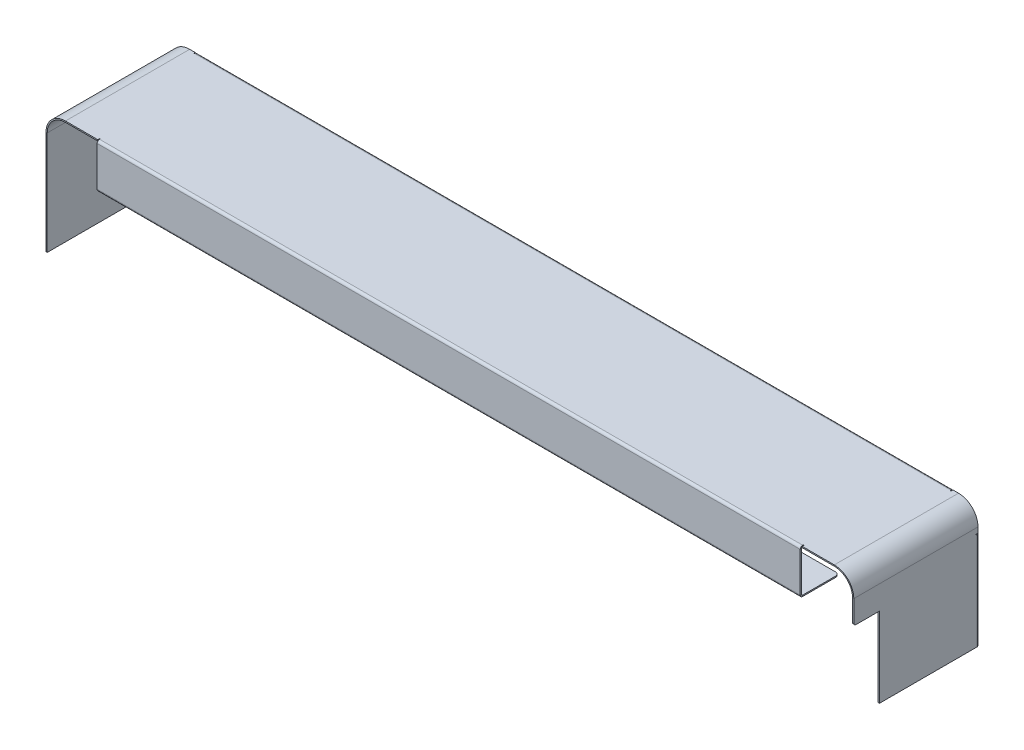
from build123d import *

# Parameters (mm, degrees)
BASE_FLANGE1_DEPTH             = 102
EDGE_FLANGE1_STRIP_W           = 6
EDGE_FLANGE1_STRIP_H           = 1
EDGE_FLANGE1_STRIP_CUT_DEPTH   = 621.4
EDGE_FLANGE1_RELIEF_W          = 6.5
EDGE_FLANGE1_RELIEF_H          = 0.5
EDGE_FLANGE1_RELIEF_CUT_DEPTH  = 1
EDGE_FLANGE1_DEPTH             = 621.4
EDGE_FLANGE2_STRIP_W           = 6
EDGE_FLANGE2_STRIP_H           = 1
EDGE_FLANGE2_STRIP_CUT_DEPTH   = 621.4
EDGE_FLANGE2_DEPTH             = 621.4
EDGE_FLANGE3_STRIP_W           = 6
EDGE_FLANGE3_STRIP_H           = 1
EDGE_FLANGE3_STRIP_CUT_DEPTH   = 80
EDGE_FLANGE3_RELIEF_W          = 6.5
EDGE_FLANGE3_RELIEF_H          = 0.5
EDGE_FLANGE3_RELIEF_CUT_DEPTH  = 1
EDGE_FLANGE3_DEPTH             = 80
EDGE_FLANGE4_STRIP_W           = 6
EDGE_FLANGE4_STRIP_H           = 1
EDGE_FLANGE4_STRIP_CUT_DEPTH   = 80
EDGE_FLANGE4_DEPTH             = 80
EDGE_FLANGE5_STRIP_W           = 6
EDGE_FLANGE5_STRIP_H           = 1
EDGE_FLANGE5_STRIP_CUT_DEPTH   = 577.4
EDGE_FLANGE5_RELIEF_W          = 6.5
EDGE_FLANGE5_RELIEF_H          = 0.5
EDGE_FLANGE5_RELIEF_CUT_DEPTH  = 1
EDGE_FLANGE5_DEPTH             = 577.4
SKETCH25_R                     = 2.5
CUT_EXTRUDE1_DEPTH             = 3
SKETCH26_R                     = 2.5
CUT_EXTRUDE2_DEPTH             = 3
CUT_EXTRUDE2_DIRECTION_2_REACH = 661.221
EDGE_FLANGE7_STRIP_W           = 6
EDGE_FLANGE7_STRIP_H           = 1
EDGE_FLANGE7_STRIP_CUT_DEPTH   = 577.4
EDGE_FLANGE7_DEPTH             = 577.4
EDGE_FLANGE7_FLAT_DEPTH        = 1
SKETCH30_W                     = 21
SKETCH30_H                     = 65.6
CUT_EXTRUDE3_DEPTH             = 10
FILLET1_R                      = 2


# Sheet-metal steps are written as plain solids
with BuildPart() as part:
    # Sketch1 → Base-Flange1 (new body)
    with BuildSketch(Plane.XY):
        with BuildLine():
            Line((-330.7, -100), (-330.7, -15))
            ThreePointArc((-330.7, -15), (-326.306601718, -4.393398282), (-315.7, 0))
            Line((-315.7, 0), (315.7, 0))
            ThreePointArc((315.7, 0), (326.306601718, -4.393398282), (330.7, -15))
            Line((330.7, -15), (330.7, -100))
            Line((330.7, -100), (331.7, -100))
            Line((331.7, -100), (331.7, -15))
            ThreePointArc((331.7, -15), (327.013708499, -3.686291501), (315.7, 1))
            Line((315.7, 1), (-315.7, 1))
            ThreePointArc((-315.7, 1), (-327.013708499, -3.686291501), (-331.7, -15))
            Line((-331.7, -15), (-331.7, -100))
            Line((-331.7, -100), (-330.7, -100))
        make_face()
    extrude(amount=BASE_FLANGE1_DEPTH)

    # Edge-Flange1 strip (across the edge) → Edge-Flange1 strip cut (cut)
    with BuildSketch(Plane(origin=(-310.7, 0, 0), x_dir=(0, 0, 1), z_dir=(1, 0, 0))):
        with Locations((-2, -0.5)):
            Rectangle(EDGE_FLANGE1_STRIP_W, EDGE_FLANGE1_STRIP_H)
    extrude(amount=EDGE_FLANGE1_STRIP_CUT_DEPTH, mode=Mode.SUBTRACT)

    # Edge-Flange1 relief (on the sheet) → Edge-Flange1 relief cut (cut)
    with BuildSketch(Plane(origin=(-310.7, 0, 1), x_dir=(0, 0, 1), z_dir=(0, -1, 0))):
        with Locations((-2.75, 0.25)):
            Rectangle(EDGE_FLANGE1_RELIEF_W, EDGE_FLANGE1_RELIEF_H)
        with Locations((-2.75, -621.65)):
            Rectangle(EDGE_FLANGE1_RELIEF_W, EDGE_FLANGE1_RELIEF_H)
    extrude(amount=-EDGE_FLANGE1_RELIEF_CUT_DEPTH, mode=Mode.SUBTRACT)

    # Edge-Flange1 section (across the edge) → Edge-Flange1 (add)
    with BuildSketch(Plane(origin=(-310.7, 0, 0), x_dir=(0, 0, 1), z_dir=(1, 0, 0))):
        with BuildLine():
            Line((-1, 1), (-1, 19))
            Line((-1, 19), (0, 19))
            Line((0, 19), (0, 1))
            ThreePointArc((0, 1), (0.292893219, 0.292893219), (1, 0))
            Line((1, 0), (1, -1))
            ThreePointArc((1, -1), (-0.414213562, -0.414213562), (-1, 1))
        make_face()
    extrude(amount=EDGE_FLANGE1_DEPTH)

    # Edge-Flange2 strip (across the edge) → Edge-Flange2 strip cut (cut)
    with BuildSketch(Plane(origin=(-310.7, -19, 0), x_dir=(0, 1, 0), z_dir=(1, 0, 0))):
        with Locations((-1, -0.5)):
            Rectangle(EDGE_FLANGE2_STRIP_W, EDGE_FLANGE2_STRIP_H)
    extrude(amount=EDGE_FLANGE2_STRIP_CUT_DEPTH, mode=Mode.SUBTRACT)

    # Edge-Flange2 section (across the edge) → Edge-Flange2 (add)
    with BuildSketch(Plane(origin=(-310.7, -19, 0), x_dir=(0, 1, 0), z_dir=(1, 0, 0))):
        with BuildLine():
            Line((0, 1), (0, 12))
            Line((0, 12), (1, 12))
            Line((1, 12), (1, 1))
            ThreePointArc((1, 1), (1.292893219, 0.292893219), (2, 0))
            Line((2, 0), (2, -1))
            ThreePointArc((2, -1), (0.585786438, -0.414213562), (0, 1))
        make_face()
    extrude(amount=EDGE_FLANGE2_DEPTH)

    # Edge-Flange3 strip (across the edge) → Edge-Flange3 strip cut (cut)
    with BuildSketch(Plane(origin=(-330.7, -100, 0), x_dir=(0, 0, 1), z_dir=(0, 1, 0))):
        with Locations((-2, -0.5)):
            Rectangle(EDGE_FLANGE3_STRIP_W, EDGE_FLANGE3_STRIP_H)
    edge_flange3_strip_cut = extrude(amount=EDGE_FLANGE3_STRIP_CUT_DEPTH, mode=Mode.SUBTRACT)

    # Edge-Flange3 relief (on the sheet) → Edge-Flange3 relief cut (cut)
    with BuildSketch(Plane(origin=(-330.7, -100, 1), x_dir=(0, 0, 1), z_dir=(1, 0, 0))):
        with Locations((-2.75, -80.25)):
            Rectangle(EDGE_FLANGE3_RELIEF_W, EDGE_FLANGE3_RELIEF_H)
    edge_flange3_relief_cut = extrude(amount=-EDGE_FLANGE3_RELIEF_CUT_DEPTH, mode=Mode.SUBTRACT)

    # Edge-Flange3 section (across the edge) → Edge-Flange3 (add)
    with BuildSketch(Plane(origin=(-330.7, -100, 0), x_dir=(0, 0, 1), z_dir=(0, 1, 0))):
        with BuildLine():
            Line((-1, 1), (-1, 19))
            Line((-1, 19), (0, 19))
            Line((0, 19), (0, 1))
            ThreePointArc((0, 1), (0.292893219, 0.292893219), (1, 0))
            Line((1, 0), (1, -1))
            ThreePointArc((1, -1), (-0.414213562, -0.414213562), (-1, 1))
        make_face()
    edge_flange3 = extrude(amount=EDGE_FLANGE3_DEPTH)

    # Edge-Flange4 strip (across the edge) → Edge-Flange4 strip cut (cut)
    with BuildSketch(Plane(origin=(-311.7, -100, 0), x_dir=(-1, 0, 0), z_dir=(0, 1, 0))):
        with Locations((-1, -0.5)):
            Rectangle(EDGE_FLANGE4_STRIP_W, EDGE_FLANGE4_STRIP_H)
    edge_flange4_strip_cut = extrude(amount=EDGE_FLANGE4_STRIP_CUT_DEPTH, mode=Mode.SUBTRACT)

    # Edge-Flange4 section (across the edge) → Edge-Flange4 (add)
    with BuildSketch(Plane(origin=(-311.7, -100, 0), x_dir=(-1, 0, 0), z_dir=(0, 1, 0))):
        with BuildLine():
            Line((0, 1), (0, 12))
            Line((0, 12), (1, 12))
            Line((1, 12), (1, 1))
            ThreePointArc((1, 1), (1.292893219, 0.292893219), (2, 0))
            Line((2, 0), (2, -1))
            ThreePointArc((2, -1), (0.585786438, -0.414213562), (0, 1))
        make_face()
    edge_flange4 = extrude(amount=EDGE_FLANGE4_DEPTH)

    # Mirror1: Edge-Flange3 strip cut, Edge-Flange3 relief cut, Edge-Flange3, Edge-Flange4 strip cut, Edge-Flange4 across plane
    add(edge_flange3_strip_cut.mirror(Plane(origin=(0, 0, 0), x_dir=(0, 0, 1), z_dir=(1, 0, 0))), mode=Mode.SUBTRACT)
    add(edge_flange3_relief_cut.mirror(Plane(origin=(0, 0, 0), x_dir=(0, 0, 1), z_dir=(1, 0, 0))), mode=Mode.SUBTRACT)
    add(edge_flange3.mirror(Plane(origin=(0, 0, 0), x_dir=(0, 0, 1), z_dir=(1, 0, 0))))
    add(edge_flange4_strip_cut.mirror(Plane(origin=(0, 0, 0), x_dir=(0, 0, 1), z_dir=(1, 0, 0))), mode=Mode.SUBTRACT)
    add(edge_flange4.mirror(Plane(origin=(0, 0, 0), x_dir=(0, 0, 1), z_dir=(1, 0, 0))))

    # Edge-Flange5 strip (across the edge) → Edge-Flange5 strip cut (cut)
    with BuildSketch(Plane(origin=(288.7, 0, 102), x_dir=(0, 0, -1), z_dir=(-1, 0, 0))):
        with Locations((-2, -0.5)):
            Rectangle(EDGE_FLANGE5_STRIP_W, EDGE_FLANGE5_STRIP_H)
    extrude(amount=EDGE_FLANGE5_STRIP_CUT_DEPTH, mode=Mode.SUBTRACT)

    # Edge-Flange5 relief (on the sheet) → Edge-Flange5 relief cut (cut)
    with BuildSketch(Plane(origin=(288.7, 0, 101), x_dir=(0, 0, -1), z_dir=(0, -1, 0))):
        with Locations((-2.75, 0.25)):
            Rectangle(EDGE_FLANGE5_RELIEF_W, EDGE_FLANGE5_RELIEF_H)
        with Locations((-2.75, -577.65)):
            Rectangle(EDGE_FLANGE5_RELIEF_W, EDGE_FLANGE5_RELIEF_H)
    extrude(amount=-EDGE_FLANGE5_RELIEF_CUT_DEPTH, mode=Mode.SUBTRACT)

    # Edge-Flange5 section (across the edge) → Edge-Flange5 (add)
    with BuildSketch(Plane(origin=(288.7, 0, 102), x_dir=(0, 0, -1), z_dir=(-1, 0, 0))):
        with BuildLine():
            Line((-1, 1), (-1, 35.5))
            Line((-1, 35.5), (0, 35.5))
            Line((0, 35.5), (0, 1))
            ThreePointArc((0, 1), (0.292893219, 0.292893219), (1, 0))
            Line((1, 0), (1, -1))
            ThreePointArc((1, -1), (-0.414213562, -0.414213562), (-1, 1))
        make_face()
    extrude(amount=EDGE_FLANGE5_DEPTH)

    # Sketch25 → Cut-Extrude1 (cut)
    with BuildSketch(Plane.XZ.offset(19)):
        with Locations(Location((-249.7, 6, 0), (0, 0, 270))):
            Circle(SKETCH25_R)
        with Locations(Location((-69.7, 6, 0), (0, 0, 270))):
            Circle(SKETCH25_R)
        with Locations(Location((110.3, 6, 0), (0, 0, 270))):
            Circle(SKETCH25_R)
        with Locations(Location((290.3, 6, 0), (0, 0, 270))):
            Circle(SKETCH25_R)
        with Locations((470.3, 6)):
            Circle(SKETCH25_R)
        with Locations((650.3, 6)):
            Circle(SKETCH25_R)
        with Locations((830.3, 6)):
            Circle(SKETCH25_R)
    extrude(amount=-CUT_EXTRUDE1_DEPTH, mode=Mode.SUBTRACT)

    # Sketch26 → Cut-Extrude2 (cut)
    with BuildSketch(Plane(origin=(-311.7, 0, 0), x_dir=(0, 0, -1), z_dir=(1, 0, 0))):
        with Locations((-6, -68)):
            Circle(SKETCH26_R)
    extrude(amount=-CUT_EXTRUDE2_DEPTH, mode=Mode.SUBTRACT)

    # Cut-Extrude2 direction 2: up to this face of the body (flat: up to its plane)
    cut_extrude2_direction_2_end = Plane(part.part.faces().sort_by_distance((312.7, -60, 6.5))[0])
    # Sketch26 → Cut-Extrude2 direction 2 (cut, up to the picked face)
    with BuildSketch(Plane(origin=(-311.7, 0, 0), x_dir=(0, 0, -1), z_dir=(1, 0, 0)), mode=Mode.PRIVATE) as cut_extrude2_direction_2_sk1:
        with Locations((-6, -68)):
            Circle(SKETCH26_R)
    cut_extrude2_direction_2_tool1 = split(extrude(cut_extrude2_direction_2_sk1.sketch, amount=CUT_EXTRUDE2_DIRECTION_2_REACH, mode=Mode.PRIVATE), bisect_by=cut_extrude2_direction_2_end, keep=Keep.BOTH, mode=Mode.PRIVATE)
    add(cut_extrude2_direction_2_tool1.solids().sort_by(Axis((-311.7, -68, 6), (1, 0, 0)))[0], mode=Mode.SUBTRACT)

    # Edge-Flange7 strip (across the edge) → Edge-Flange7 strip cut (cut)
    with BuildSketch(Plane(origin=(288.7, -35.5, 102), x_dir=(0, 1, 0), z_dir=(-1, 0, 0))):
        with Locations((-1, -0.5)):
            Rectangle(EDGE_FLANGE7_STRIP_W, EDGE_FLANGE7_STRIP_H)
    extrude(amount=EDGE_FLANGE7_STRIP_CUT_DEPTH, mode=Mode.SUBTRACT)

    # Edge-Flange7 bend section (across the edge) → Edge-Flange7 (add)
    with BuildSketch(Plane(origin=(288.7, -35.5, 102), x_dir=(0, 1, 0), z_dir=(-1, 0, 0))):
        with BuildLine():
            Line((0, 1), (1, 1))
            ThreePointArc((1, 1), (1.292893219, 0.292893219), (2, 0))
            Line((2, 0), (2, -1))
            ThreePointArc((2, -1), (0.585786438, -0.414213562), (0, 1))
        make_face()
    extrude(amount=EDGE_FLANGE7_DEPTH)

    # Edge-Flange7 profile (on flange) → Edge-Flange7 flat (add)
    with BuildSketch(Plane(origin=(0, -35.5, 102), x_dir=(1, 0, 0), z_dir=(0, 1, 0))):
        with BuildLine():
            Line((-288.7, 1), (288.7, 1))
            Line((288.7, 1), (288.7, 28))
            ThreePointArc((288.7, 28), (287.821320344, 30.121320344), (285.7, 31))
            Line((285.7, 31), (-285.7, 31))
            ThreePointArc((-285.7, 31), (-287.821320344, 30.121320344), (-288.7, 28))
            Line((-288.7, 28), (-288.7, 1))
        make_face()
    extrude(amount=EDGE_FLANGE7_FLAT_DEPTH)

    # Sketch30 → Cut-Extrude3 (cut)
    with BuildSketch(Plane(origin=(331.7, 0, 0), x_dir=(0, 0, -1), z_dir=(1, 0, 0))):
        with Locations((-91.5, -67.2)):
            Rectangle(SKETCH30_W, SKETCH30_H)
    extrude(amount=-CUT_EXTRUDE3_DEPTH, mode=Mode.SUBTRACT)

    # Fillet1
    fillet1_edges = [part.edges().sort_by_distance(p)[0] for p in [
        (331.2, -34.4, 102),
    ]]
    fillet(fillet1_edges, radius=FILLET1_R)


solid = part.part
